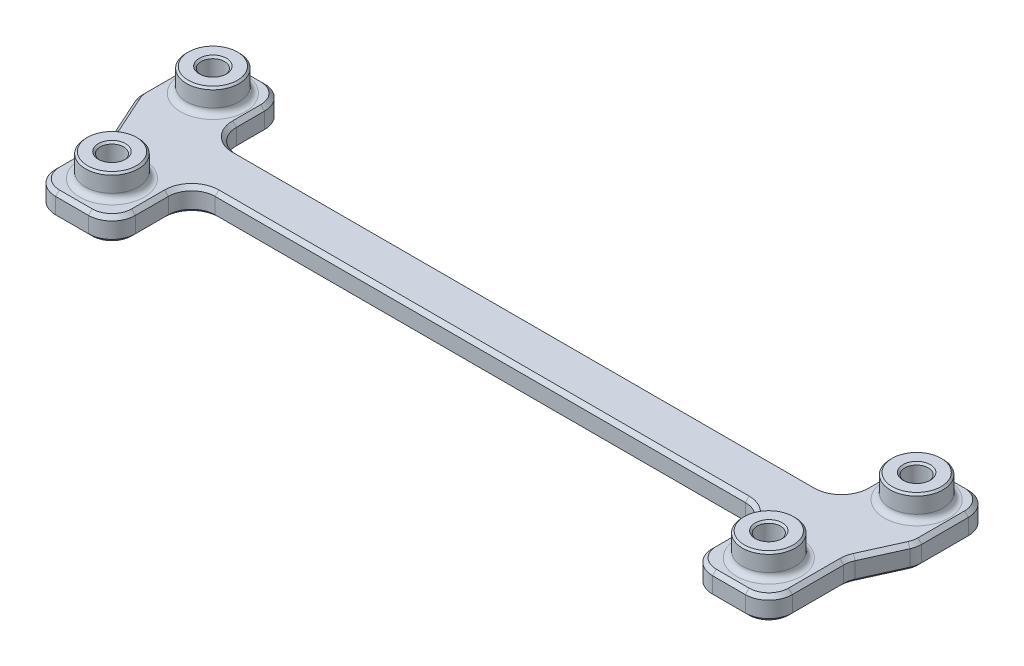
from build123d import *

# Parameters (mm, degrees)
BOSS_EXTRUDE2_DEPTH = 3.175
SKETCH3_R           = 3.571875
BOSS_EXTRUDE3_DEPTH = 3.175
CUT_EXTRUDE1_REACH  = 56.9
SKETCH4_R           = 1.5875
FILLET1_R           = 3.175
FILLET2_R           = 0.79375
CHAMFER1_SIZE       = 0.508
CHAMFER2_SIZE       = 0.254


with BuildPart() as part:
    # Sketch2 → Boss-Extrude2 (new body)
    with BuildSketch(Plane(origin=(0, 0, 0), x_dir=(1, 0, 0), z_dir=(0, 1, 0))):
        Polygon((-39.0525, -13.97), (-39.0525, -3.175), (39.0525, -3.175), (39.0525, -13.97), (49.8475, -13.97), (49.8475, -3.175), (52.71135, 3.175), (52.71135, 13.3477), (42.53865, 13.3477), (42.53865, 3.175), (-42.53865, 3.175), (-42.53865, 13.3477), (-52.71135, 13.3477), (-52.71135, 3.175), (-49.8475, -3.175), (-49.8475, -13.97), align=None)
    extrude(amount=BOSS_EXTRUDE2_DEPTH)

    # Sketch3 → Boss-Extrude3 (add)
    with BuildSketch(Plane(origin=(0, 3.175, 0), x_dir=(1, 0, 0), z_dir=(0, 1, 0))):
        with Locations((-47.625, 8.26135)):
            Circle(SKETCH3_R)
        with Locations((-44.45, -8.5725)):
            Circle(SKETCH3_R)
        with Locations((44.45, -8.5725)):
            Circle(SKETCH3_R)
        with Locations((47.625, 8.26135)):
            Circle(SKETCH3_R)
    extrude(amount=BOSS_EXTRUDE3_DEPTH)

    # Sketch4 → Cut-Extrude1 (cut, up to next)
    with BuildSketch(Plane.XZ, mode=Mode.PRIVATE) as cut_extrude1_sk1:
        with Locations((-44.45, 8.5725)):
            Circle(SKETCH4_R)
    cut_extrude1_tool1 = extrude(cut_extrude1_sk1.sketch, amount=-CUT_EXTRUDE1_REACH, mode=Mode.PRIVATE) & part.part
    # Sketch4 → Cut-Extrude1 (cut, up to next)
    with BuildSketch(Plane.XZ, mode=Mode.PRIVATE) as cut_extrude1_sk2:
        with Locations((-47.625, -8.26135)):
            Circle(SKETCH4_R)
    cut_extrude1_tool2 = extrude(cut_extrude1_sk2.sketch, amount=-CUT_EXTRUDE1_REACH, mode=Mode.PRIVATE) & part.part
    # Sketch4 → Cut-Extrude1 (cut, up to next)
    with BuildSketch(Plane.XZ, mode=Mode.PRIVATE) as cut_extrude1_sk3:
        with Locations((47.625, -8.26135)):
            Circle(SKETCH4_R)
    cut_extrude1_tool3 = extrude(cut_extrude1_sk3.sketch, amount=-CUT_EXTRUDE1_REACH, mode=Mode.PRIVATE) & part.part
    # Sketch4 → Cut-Extrude1 (cut, up to next)
    with BuildSketch(Plane.XZ, mode=Mode.PRIVATE) as cut_extrude1_sk4:
        with Locations((44.45, 8.5725)):
            Circle(SKETCH4_R)
    cut_extrude1_tool4 = extrude(cut_extrude1_sk4.sketch, amount=-CUT_EXTRUDE1_REACH, mode=Mode.PRIVATE) & part.part
    add(cut_extrude1_tool1.solids().sort_by_distance((-44.45, 0, 8.5725))[0], mode=Mode.SUBTRACT)
    add(cut_extrude1_tool2.solids().sort_by_distance((-47.625, 0, -8.26135))[0], mode=Mode.SUBTRACT)
    add(cut_extrude1_tool3.solids().sort_by_distance((47.625, 0, -8.26135))[0], mode=Mode.SUBTRACT)
    add(cut_extrude1_tool4.solids().sort_by_distance((44.45, 0, 8.5725))[0], mode=Mode.SUBTRACT)

    # Fillet1
    fillet1_edges = [part.edges().sort_by_distance(p)[0] for p in [
        (-42.53865, 1.5875, -13.3477),
        (-42.53865, 1.5875, -3.175),
        (42.53865, 1.5875, -3.175),
        (42.53865, 1.5875, -13.3477),
        (52.71135, 1.5875, -13.3477),
        (52.71135, 1.5875, -3.175),
        (49.8475, 1.5875, 3.175),
        (49.8475, 1.5875, 13.97),
        (39.0525, 1.5875, 13.97),
        (39.0525, 1.5875, 3.175),
        (-39.0525, 1.5875, 13.97),
        (-49.8475, 1.5875, 13.97),
        (-49.8475, 1.5875, 3.175),
        (-52.71135, 1.5875, -3.175),
        (-52.71135, 1.5875, -13.3477),
        (-39.0525, 1.5875, 3.175),
    ]]
    fillet(fillet1_edges, radius=FILLET1_R)

    # Fillet2
    fillet2_edges = [part.edges().sort_by_distance(p)[0] for p in [
        (40.878125, 3.175, 8.5725),
        (44.053125, 3.175, -8.26135),
        (-51.196875, 3.175, -8.26135),
        (-48.021875, 3.175, 8.5725),
    ]]
    fillet(fillet2_edges, radius=FILLET2_R)

    # Chamfer1
    chamfer1_edges = [part.edges().sort_by_distance(p)[0] for p in [
        (0, 3.175, -3.175),
        (-41.60871403, 3.175, -4.10493597),
        (41.60871403, 3.175, -4.10493597),
        (-42.53865, 3.175, -8.26135),
        (42.53865, 3.175, -8.26135),
        (-43.46858597, 3.175, -12.41776403),
        (43.46858597, 3.175, -12.41776403),
        (-47.625, 3.175, -13.3477),
        (47.625, 3.175, -13.3477),
        (-51.78141403, 3.175, -12.41776403),
        (51.78141403, 3.175, -12.41776403),
        (-52.71135, 3.175, -7.015272864),
        (52.71135, 3.175, -7.015272864),
        (-52.640373335, 3.175, -3.190264917),
        (52.640373335, 3.175, -3.190264917),
        (-51.279425, 3.175, 0),
        (51.279425, 3.175, 0),
        (-49.918476665, 3.175, 3.190264917),
        (49.918476665, 3.175, 3.190264917),
        (-49.8475, 3.175, 7.326422864),
        (49.8475, 3.175, 7.326422864),
        (-48.91756403, 3.175, 13.04006403),
        (48.91756403, 3.175, 13.04006403),
        (-44.45, 3.175, 13.97),
        (44.45, 3.175, 13.97),
        (-39.98243597, 3.175, 13.04006403),
        (39.98243597, 3.175, 13.04006403),
        (-39.0525, 3.175, 8.5725),
        (39.0525, 3.175, 8.5725),
        (-38.12256403, 3.175, 4.10493597),
        (38.12256403, 3.175, 4.10493597),
        (0, 3.175, 3.175),
        (0, 0, -3.175),
        (-41.60871403, 0, -4.10493597),
        (41.60871403, 0, -4.10493597),
        (-42.53865, 0, -8.26135),
        (42.53865, 0, -8.26135),
        (-43.46858597, 0, -12.41776403),
        (43.46858597, 0, -12.41776403),
        (-47.625, 0, -13.3477),
        (47.625, 0, -13.3477),
        (-51.78141403, 0, -12.41776403),
        (51.78141403, 0, -12.41776403),
        (-52.71135, 0, -7.015272864),
        (52.71135, 0, -7.015272864),
        (-52.640373335, 0, -3.190264917),
        (52.640373335, 0, -3.190264917),
        (-51.279425, 0, 0),
        (51.279425, 0, 0),
        (-49.918476665, 0, 3.190264917),
        (49.918476665, 0, 3.190264917),
        (-49.8475, 0, 7.326422864),
        (49.8475, 0, 7.326422864),
        (-48.91756403, 0, 13.04006403),
        (48.91756403, 0, 13.04006403),
        (-44.45, 0, 13.97),
        (44.45, 0, 13.97),
        (-39.98243597, 0, 13.04006403),
        (39.98243597, 0, 13.04006403),
        (-39.0525, 0, 8.5725),
        (39.0525, 0, 8.5725),
        (-38.12256403, 0, 4.10493597),
        (38.12256403, 0, 4.10493597),
        (0, 0, 3.175),
    ]]
    chamfer(chamfer1_edges, length=CHAMFER1_SIZE)

    # Chamfer2
    chamfer2_edges = [part.edges().sort_by_distance(p)[0] for p in [
        (42.8625, 0, 8.5725),
        (42.8625, 6.35, 8.5725),
        (46.0375, 0, -8.26135),
        (46.0375, 6.35, -8.26135),
        (-49.2125, 0, -8.26135),
        (-49.2125, 6.35, -8.26135),
        (-46.0375, 0, 8.5725),
        (-46.0375, 6.35, 8.5725),
        (40.878125, 6.35, 8.5725),
        (44.053125, 6.35, -8.26135),
        (-51.196875, 6.35, -8.26135),
        (-48.021875, 6.35, 8.5725),
    ]]
    chamfer(chamfer2_edges, length=CHAMFER2_SIZE)


solid = part.part
